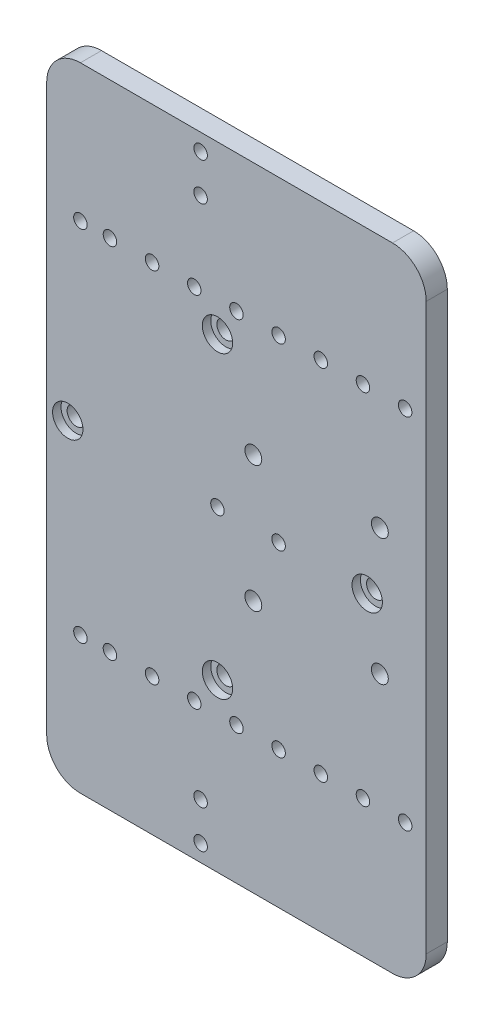
from build123d import *

# Parameters (mm, degrees)
SKETCH_1_W          = 90
SKETCH_1_H          = 150
SKETCH_1_R          = 2
SKETCH_1_R_2        = 2.15
SKETCH_1_R_3        = 1.6
EXTRUDE_1_DEPTH     = 5
FILLET_1_R          = 8
SKETCH_2_R          = 3.6
CUT_EXTRUDE_1_DEPTH = 2
SKETCH_4_R          = 30
EXTRUDE_2_DEPTH     = 3


with BuildPart() as part:
    # 草图1 → 凸台-拉伸1 (new body)
    with BuildSketch(Plane.XY):
        with Locations((45, -75)):
            Rectangle(SKETCH_1_W, SKETCH_1_H)
        with Locations((79, -60)):
            Circle(SKETCH_1_R, mode=Mode.SUBTRACT)
        with Locations((79, -90)):
            Circle(SKETCH_1_R, mode=Mode.SUBTRACT)
        with Locations((49, -60)):
            Circle(SKETCH_1_R, mode=Mode.SUBTRACT)
        with Locations((49, -90)):
            Circle(SKETCH_1_R, mode=Mode.SUBTRACT)
        with Locations((40.5, -39.5)):
            Circle(SKETCH_1_R_2, mode=Mode.SUBTRACT)
        with Locations((40.5, -110.5)):
            Circle(SKETCH_1_R_2, mode=Mode.SUBTRACT)
        with Locations((76, -75)):
            Circle(SKETCH_1_R_2, mode=Mode.SUBTRACT)
        with Locations((5, -75)):
            Circle(SKETCH_1_R_2, mode=Mode.SUBTRACT)
        with Locations((85, -117.5)):
            Circle(SKETCH_1_R_3, mode=Mode.SUBTRACT)
        with Locations((75, -117.5)):
            Circle(SKETCH_1_R_3, mode=Mode.SUBTRACT)
        with Locations((65, -117.5)):
            Circle(SKETCH_1_R_3, mode=Mode.SUBTRACT)
        with Locations((55, -117.5)):
            Circle(SKETCH_1_R_3, mode=Mode.SUBTRACT)
        with Locations((45, -117.5)):
            Circle(SKETCH_1_R_3, mode=Mode.SUBTRACT)
        with Locations((85, -32.5)):
            Circle(SKETCH_1_R_3, mode=Mode.SUBTRACT)
        with Locations((75, -32.5)):
            Circle(SKETCH_1_R_3, mode=Mode.SUBTRACT)
        with Locations((65, -32.5)):
            Circle(SKETCH_1_R_3, mode=Mode.SUBTRACT)
        with Locations((55, -32.5)):
            Circle(SKETCH_1_R_3, mode=Mode.SUBTRACT)
        with Locations((45, -32.5)):
            Circle(SKETCH_1_R_3, mode=Mode.SUBTRACT)
        with Locations((35, -117.5)):
            Circle(SKETCH_1_R_3, mode=Mode.SUBTRACT)
        with Locations((25, -117.5)):
            Circle(SKETCH_1_R_3, mode=Mode.SUBTRACT)
        with Locations((15, -117.5)):
            Circle(SKETCH_1_R_3, mode=Mode.SUBTRACT)
        with Locations((35, -32.5)):
            Circle(SKETCH_1_R_3, mode=Mode.SUBTRACT)
        with Locations((25, -32.5)):
            Circle(SKETCH_1_R_3, mode=Mode.SUBTRACT)
        with Locations((15, -32.5)):
            Circle(SKETCH_1_R_3, mode=Mode.SUBTRACT)
        with Locations((8, -117.5)):
            Circle(SKETCH_1_R_3, mode=Mode.SUBTRACT)
        with Locations((8, -32.5)):
            Circle(SKETCH_1_R_3, mode=Mode.SUBTRACT)
        with Locations((36.5, -4)):
            Circle(SKETCH_1_R_3, mode=Mode.SUBTRACT)
        with Locations((36.5, -13)):
            Circle(SKETCH_1_R_3, mode=Mode.SUBTRACT)
        with Locations((36.5, -137)):
            Circle(SKETCH_1_R_3, mode=Mode.SUBTRACT)
        with Locations((36.5, -146)):
            Circle(SKETCH_1_R_3, mode=Mode.SUBTRACT)
        with Locations((55, -75)):
            Circle(SKETCH_1_R_3, mode=Mode.SUBTRACT)
        with Locations((40.5, -75)):
            Circle(SKETCH_1_R_3, mode=Mode.SUBTRACT)
    extrude(amount=EXTRUDE_1_DEPTH)

    # 圆角1
    fillet_1_edges = [part.edges().sort_by_distance(p)[0] for p in [
        (0, -150, 2.5),
        (90, -150, 2.5),
        (90, 0, 2.5),
        (0, 0, 2.5),
    ]]
    fillet(fillet_1_edges, radius=FILLET_1_R)

    # 草图2 → 切除-拉伸1 (cut)
    with BuildSketch(Plane.XY.offset(5)):
        with Locations((40.5, -39.5)):
            Circle(SKETCH_2_R)
        with Locations((76, -75)):
            Circle(SKETCH_2_R)
        with Locations((5, -75)):
            Circle(SKETCH_2_R)
        with Locations((40.5, -110.5)):
            Circle(SKETCH_2_R)
    extrude(amount=-CUT_EXTRUDE_1_DEPTH, mode=Mode.SUBTRACT)

    # 草图4 → 凸台-拉伸2 (add)
    with BuildSketch(Plane(origin=(0, 0, 0), x_dir=(-1, 0, 0), z_dir=(0, 0, -1))):
        with BuildLine():
            ThreePointArc((-42.199612772, -35.036124857), (-68.784271247, -46.715728753), (-80.463875143, -73.300387228))
            ThreePointArc((-80.463875143, -73.300387228), (-71.223509147, -75), (-80.463875143, -76.699612772))
            ThreePointArc((-80.463875143, -76.699612772), (-68.784271247, -103.284271247), (-42.199612772, -114.963875143))
            ThreePointArc((-42.199612772, -114.963875143), (-40.5, -105.723509147), (-38.800387228, -114.963875143))
            ThreePointArc((-38.800387228, -114.963875143), (-12.215728753, -103.284271247), (-0.536124857, -76.699612772))
            ThreePointArc((-0.536124857, -76.699612772), (-9.776490853, -75), (-0.536124857, -73.300387228))
            ThreePointArc((-0.536124857, -73.300387228), (-12.215728753, -46.715728753), (-38.800387228, -35.036124857))
            ThreePointArc((-38.800387228, -35.036124857), (-40.5, -44.276490853), (-42.199612772, -35.036124857))
        make_face()
        with Locations((-40.5, -75)):
            Circle(SKETCH_4_R, mode=Mode.SUBTRACT)
    extrude(amount=EXTRUDE_2_DEPTH)


solid = part.part
